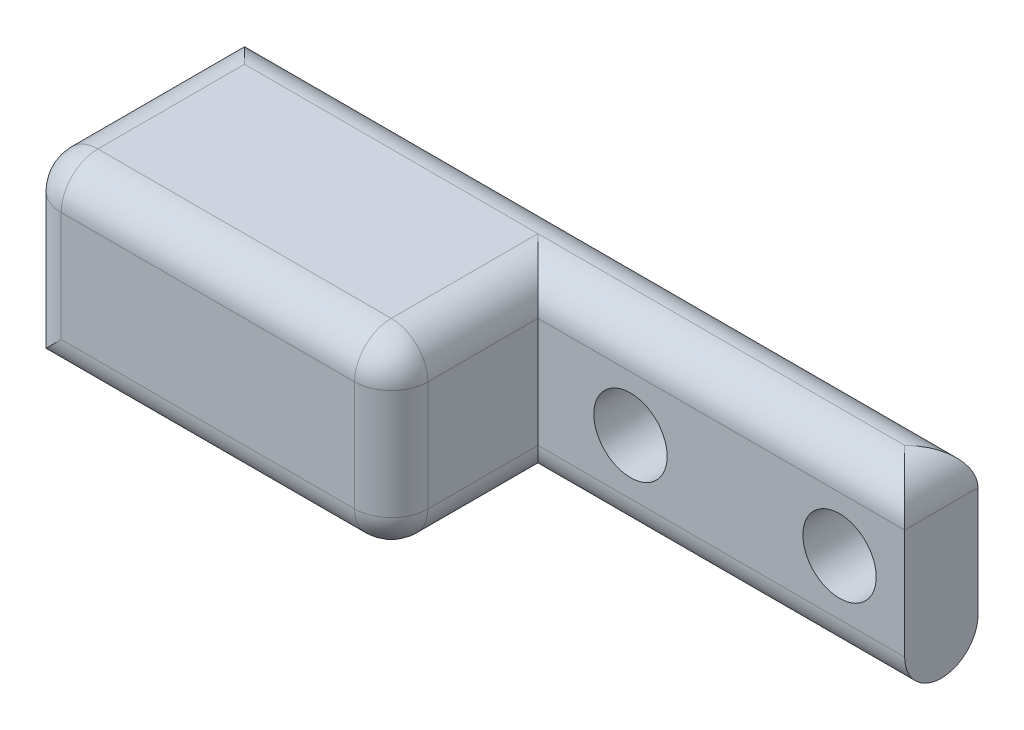
from build123d import *

# Parameters (mm, degrees)
BOSS_EXTRUDE1_DEPTH = 5
SKETCH2_R           = 1
CUT_EXTRUDE1_DEPTH  = 5
FILLET1_R           = 1


with BuildPart() as part:
    # Sketch1 → Boss-Extrude1 (new body)
    with BuildSketch(Plane(origin=(0, 0, 0), x_dir=(1, 0, 0), z_dir=(0, 1, 0))):
        Polygon((0, 0), (0, 6), (16.608456475, 6), (20, 6), (20, 4), (10, 4), (10, 0), align=None)
    extrude(amount=BOSS_EXTRUDE1_DEPTH)

    # Sketch2 → Cut-Extrude1 (cut)
    with BuildSketch(Plane.XY.offset(-4)):
        with Locations((12.523987241, 2.5)):
            Circle(SKETCH2_R)
        with Locations((18.223987241, 2.5)):
            Circle(SKETCH2_R)
    extrude(amount=-CUT_EXTRUDE1_DEPTH, mode=Mode.SUBTRACT)

    # Fillet1
    fillet1_edges = [part.edges().sort_by_distance(p)[0] for p in [
        (5, 0, 0),
        (5, 5, 0),
        (0, 5, -3),
        (10, 5, -6),
        (20, 5, -5),
        (15, 5, -4),
        (10, 5, -2),
        (0, 2.5, 0),
        (10, 2.5, 0),
        (10, 0, -2),
        (10, 0, -6),
        (15, 0, -4),
    ]]
    fillet(fillet1_edges, radius=FILLET1_R - 0.0001)  # a hair under: the kernel refuses the full size


solid = part.part
